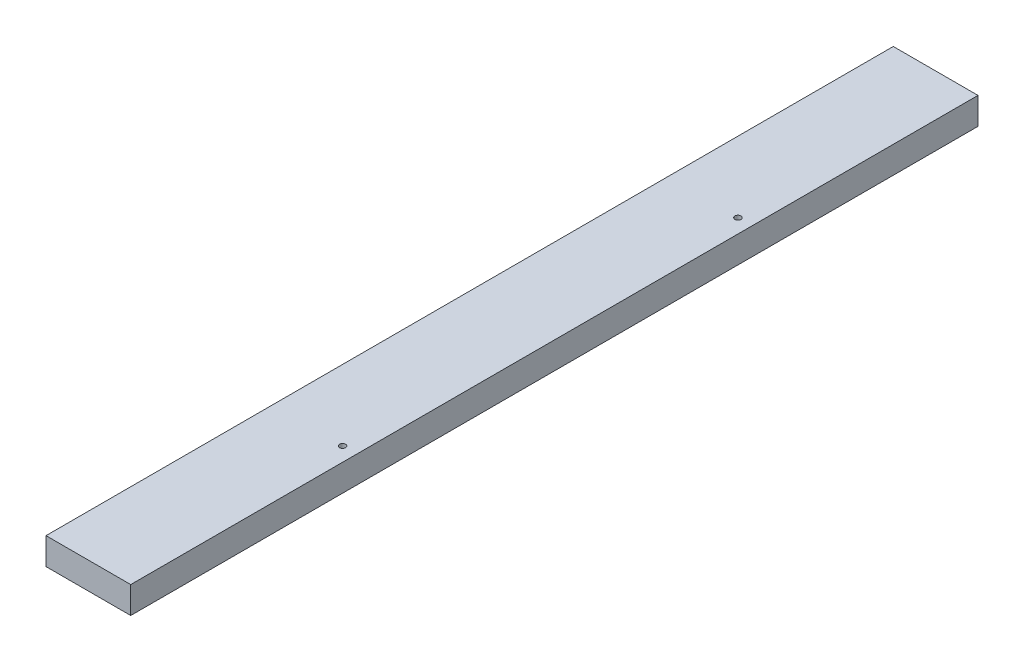
from build123d import *

# Parameters (mm, degrees)
SKETCH1_W                                       = 60
SKETCH1_H                                       = 19
BOSS_EXTRUDE1_DEPTH                             = 600
SKETCH2_R                                       = 2.5
CUT_EXTRUDE1_DEPTH                              = 10
CSK_FOR_M4_FLAT_HEAD_MACHINE_SCREW1_D           = 4.3
CSK_FOR_M4_FLAT_HEAD_MACHINE_SCREW1_CSINK_D     = 9.4
CSK_FOR_M4_FLAT_HEAD_MACHINE_SCREW1_CSINK_ANGLE = 90


with BuildPart() as part:
    # Sketch1 → Boss-Extrude1 (new body)
    with BuildSketch(Plane.XY):
        with Locations((30, 9.5)):
            Rectangle(SKETCH1_W, SKETCH1_H)
    extrude(amount=BOSS_EXTRUDE1_DEPTH)

    # Sketch2 → Cut-Extrude1 (cut)
    with BuildSketch(Plane(origin=(0, 0, 0), x_dir=(-1, 0, 0), z_dir=(0, -1, 0))):
        with Locations((-38, -10)):
            Circle(SKETCH2_R)
        with Locations((-38, -590)):
            Circle(SKETCH2_R)
    extrude(amount=-CUT_EXTRUDE1_DEPTH, mode=Mode.SUBTRACT)

    # CSK for M4 Flat Head Machine Screw1 (through all)
    with Locations(Plane(origin=(0, 0, 0), x_dir=(-1, 0, 0), z_dir=(0, -1, 0))):
        with Locations((-50, -160), (-50, -440)):
            CounterSinkHole(CSK_FOR_M4_FLAT_HEAD_MACHINE_SCREW1_D / 2, CSK_FOR_M4_FLAT_HEAD_MACHINE_SCREW1_CSINK_D / 2, counter_sink_angle=CSK_FOR_M4_FLAT_HEAD_MACHINE_SCREW1_CSINK_ANGLE)


solid = part.part
